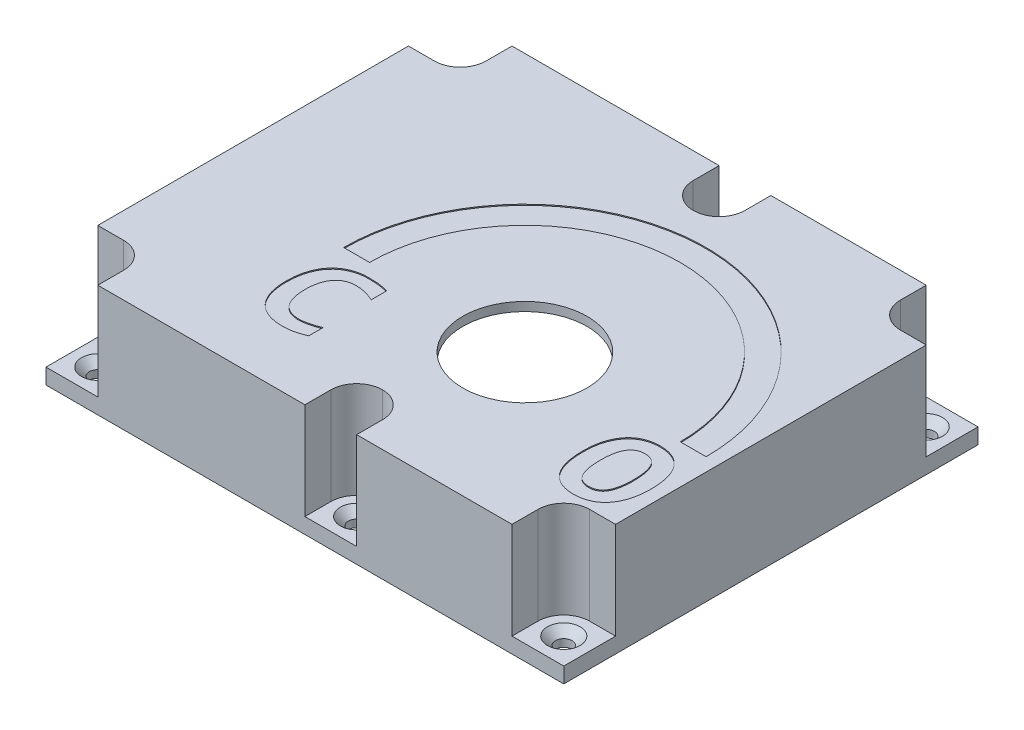
from build123d import *

# Parameters (mm, degrees)
BOSS_EXTRUDE4_DEPTH                          = 20
BOSS_EXTRUDE5_DEPTH                          = 3
BOSS_EXTRUDE6_DEPTH                          = 1.7
CSK_FOR_M3_COUNTERSUNK_FLAT_HEAD_SCR_2_COUNT = 2
CSK_FOR_M3_COUNTERSUNK_FLAT_HEAD_SCR_2_PITCH = 89.998
CSK_FOR_M3_COUNTERSUNK_FLAT_HEAD_SCR_3_COUNT = 2
CSK_FOR_M3_COUNTERSUNK_FLAT_HEAD_SCR_3_PITCH = 114.014735925
CSK_FOR_M3_COUNTERSUNK_FLAT_HEAD_SCR_4_COUNT = 2
CSK_FOR_M3_COUNTERSUNK_FLAT_HEAD_SCR_4_PITCH = 69.998
CSK_FOR_M3_COUNTERSUNK_FLAT_HEAD_SCR_5_COUNT = 2
CSK_FOR_M3_COUNTERSUNK_FLAT_HEAD_SCR_5_PITCH = 86.020462728
CSK_FOR_M3_COUNTERSUNK_FLAT_HEAD_SCR_6_COUNT = 2
CSK_FOR_M3_COUNTERSUNK_FLAT_HEAD_SCR_6_PITCH = 49.998
SKETCH7_R                                    = 12
CUT_EXTRUDE1_DEPTH                           = 69.856850528
CUT_EXTRUDE2_DEPTH                           = 0.2


with BuildPart() as part:
    # Sketch1 → Boss-Extrude4 (new body)
    with BuildSketch(Plane(origin=(0, 0, 0), x_dir=(1, 0, 0), z_dir=(0, 1, 0))):
        with BuildLine():
            Line((-49.242001852, 28.84175066), (-44.241001852, 28.84175066))
            ThreePointArc((-44.241001852, 28.84175066), (-40.706175053, 30.305923861), (-39.242001852, 33.84075066))
            Line((-39.242001852, 33.84075066), (-39.242001852, 38.84175066))
            Line((-39.242001852, 38.84175066), (0.757998148, 38.84175066))
            Line((0.757998148, 38.84175066), (0.757998148, 33.84075066))
            ThreePointArc((0.757998148, 33.84075066), (2.222171348, 30.305923861), (5.756998148, 28.84175066))
            Line((5.756998148, 28.84175066), (5.758998148, 28.84175066))
            ThreePointArc((5.758998148, 28.84175066), (9.293824947, 30.305923861), (10.757998148, 33.84075066))
            Line((10.757998148, 33.84075066), (10.757998148, 38.84175066))
            Line((10.757998148, 38.84175066), (40.757998148, 38.84175066))
            Line((40.757998148, 38.84175066), (40.757998148, 33.84075066))
            ThreePointArc((40.757998148, 33.84075066), (42.222171348, 30.305923861), (45.756998148, 28.84175066))
            Line((45.756998148, 28.84175066), (50.757998148, 28.84175066))
            Line((50.757998148, 28.84175066), (50.757998148, -31.15824934))
            Line((50.757998148, -31.15824934), (45.756998148, -31.15824934))
            ThreePointArc((45.756998148, -31.15824934), (42.222171348, -32.62242254), (40.757998148, -36.15724934))
            Line((40.757998148, -36.15724934), (40.757998148, -41.15824934))
            Line((40.757998148, -41.15824934), (10.757998148, -41.15824934))
            Line((10.757998148, -41.15824934), (10.757998148, -36.15724934))
            ThreePointArc((10.757998148, -36.15724934), (9.293824947, -32.62242254), (5.758998148, -31.15824934))
            Line((5.758998148, -31.15824934), (5.756998148, -31.15824934))
            ThreePointArc((5.756998148, -31.15824934), (2.222171348, -32.62242254), (0.757998148, -36.15724934))
            Line((0.757998148, -36.15724934), (0.757998148, -41.15824934))
            Line((0.757998148, -41.15824934), (-39.242001852, -41.15824934))
            Line((-39.242001852, -41.15824934), (-39.242001852, -36.15724934))
            ThreePointArc((-39.242001852, -36.15724934), (-40.706175053, -32.62242254), (-44.241001852, -31.15824934))
            Line((-44.241001852, -31.15824934), (-49.242001852, -31.15824934))
            Line((-49.242001852, -31.15824934), (-49.242001852, 28.84175066))
        make_face()
        with BuildLine():
            Line((-47.742001852, 27.34175066), (-44.241001852, 27.34175066))
            ThreePointArc((-44.241001852, 27.34175066), (-39.645514881, 29.245263689), (-37.742001852, 33.84075066))
            Line((-37.742001852, 33.84075066), (-37.742001852, 37.34175066))
            Line((-37.742001852, 37.34175066), (-0.742001852, 37.34175066))
            Line((-0.742001852, 37.34175066), (-0.742001852, 33.84075066))
            ThreePointArc((-0.742001852, 33.84075066), (1.161511177, 29.245263689), (5.756998148, 27.34175066))
            Line((5.756998148, 27.34175066), (5.758998148, 27.34175066))
            ThreePointArc((5.758998148, 27.34175066), (10.354485119, 29.245263689), (12.257998148, 33.84075066))
            Line((12.257998148, 33.84075066), (12.257998148, 37.34175066))
            Line((12.257998148, 37.34175066), (39.257998148, 37.34175066))
            Line((39.257998148, 37.34175066), (39.257998148, 33.84075066))
            ThreePointArc((39.257998148, 33.84075066), (41.161511177, 29.245263689), (45.756998148, 27.34175066))
            Line((45.756998148, 27.34175066), (49.257998148, 27.34175066))
            Line((49.257998148, 27.34175066), (49.257998148, -29.65824934))
            Line((49.257998148, -29.65824934), (45.756998148, -29.65824934))
            ThreePointArc((45.756998148, -29.65824934), (41.161511177, -31.561762369), (39.257998148, -36.15724934))
            Line((39.257998148, -36.15724934), (39.257998148, -39.65824934))
            Line((39.257998148, -39.65824934), (12.257998148, -39.65824934))
            Line((12.257998148, -39.65824934), (12.257998148, -36.15724934))
            ThreePointArc((12.257998148, -36.15724934), (10.354485119, -31.561762369), (5.758998148, -29.65824934))
            Line((5.758998148, -29.65824934), (5.756998148, -29.65824934))
            ThreePointArc((5.756998148, -29.65824934), (1.161511177, -31.561762369), (-0.742001852, -36.15724934))
            Line((-0.742001852, -36.15724934), (-0.742001852, -39.65824934))
            Line((-0.742001852, -39.65824934), (-37.742001852, -39.65824934))
            Line((-37.742001852, -39.65824934), (-37.742001852, -36.15724934))
            ThreePointArc((-37.742001852, -36.15724934), (-39.645514881, -31.561762369), (-44.241001852, -29.65824934))
            Line((-44.241001852, -29.65824934), (-47.742001852, -29.65824934))
            Line((-47.742001852, -29.65824934), (-47.742001852, 27.34175066))
        make_face(mode=Mode.SUBTRACT)
    extrude(amount=BOSS_EXTRUDE4_DEPTH)

    # Sketch2 → Boss-Extrude5 (add)
    with BuildSketch(Plane.XZ):
        with BuildLine():
            Line((0.757998148, -38.84175066), (10.757998148, -38.84175066))
            Line((10.757998148, -38.84175066), (10.757998148, -33.84075066))
            ThreePointArc((10.757998148, -33.84075066), (9.293824947, -30.305923861), (5.758998148, -28.84175066))
            Line((5.758998148, -28.84175066), (5.756998148, -28.84175066))
            ThreePointArc((5.756998148, -28.84175066), (2.222171348, -30.305923861), (0.757998148, -33.84075066))
            Line((0.757998148, -33.84075066), (0.757998148, -38.84175066))
        make_face()
        with BuildLine():
            Line((-49.242001852, -38.84175066), (-39.242001852, -38.84175066))
            Line((-39.242001852, -38.84175066), (-39.242001852, -33.84075066))
            ThreePointArc((-39.242001852, -33.84075066), (-40.706175053, -30.305923861), (-44.241001852, -28.84175066))
            Line((-44.241001852, -28.84175066), (-49.242001852, -28.84175066))
            Line((-49.242001852, -28.84175066), (-49.242001852, -38.84175066))
        make_face()
        with BuildLine():
            Line((-49.242001852, 41.15824934), (-39.242001852, 41.15824934))
            Line((-39.242001852, 41.15824934), (-39.242001852, 36.15724934))
            ThreePointArc((-39.242001852, 36.15724934), (-40.706175053, 32.62242254), (-44.241001852, 31.15824934))
            Line((-44.241001852, 31.15824934), (-49.242001852, 31.15824934))
            Line((-49.242001852, 31.15824934), (-49.242001852, 41.15824934))
        make_face()
        with BuildLine():
            Line((50.757998148, 41.15824934), (40.757998148, 41.15824934))
            Line((40.757998148, 41.15824934), (40.757998148, 36.15724934))
            ThreePointArc((40.757998148, 36.15724934), (42.222171348, 32.62242254), (45.756998148, 31.15824934))
            Line((45.756998148, 31.15824934), (50.757998148, 31.15824934))
            Line((50.757998148, 31.15824934), (50.757998148, 41.15824934))
        make_face()
        with BuildLine():
            Line((50.757998148, -38.84175066), (40.757998148, -38.84175066))
            Line((40.757998148, -38.84175066), (40.757998148, -33.84075066))
            ThreePointArc((40.757998148, -33.84075066), (42.222171348, -30.305923861), (45.756998148, -28.84175066))
            Line((45.756998148, -28.84175066), (50.757998148, -28.84175066))
            Line((50.757998148, -28.84175066), (50.757998148, -38.84175066))
        make_face()
        with BuildLine():
            Line((0.757998148, 41.15824934), (10.757998148, 41.15824934))
            Line((10.757998148, 41.15824934), (10.757998148, 36.15724934))
            ThreePointArc((10.757998148, 36.15724934), (9.293824947, 32.62242254), (5.758998148, 31.15824934))
            Line((5.758998148, 31.15824934), (5.756998148, 31.15824934))
            ThreePointArc((5.756998148, 31.15824934), (2.222171348, 32.62242254), (0.757998148, 36.15724934))
            Line((0.757998148, 36.15724934), (0.757998148, 41.15824934))
        make_face()
    extrude(amount=-BOSS_EXTRUDE5_DEPTH)

    # Sketch3 → Boss-Extrude6 (add)
    with BuildSketch(Plane(origin=(0, 20, 0), x_dir=(1, 0, 0), z_dir=(0, 1, 0))):
        with BuildLine():
            Line((-39.242001852, -41.15824934), (0.757998148, -41.15824934))
            Line((0.757998148, -41.15824934), (0.757998148, -36.15724934))
            ThreePointArc((0.757998148, -36.15724934), (2.222171348, -32.62242254), (5.756998148, -31.15824934))
            Line((5.756998148, -31.15824934), (5.758998148, -31.15824934))
            ThreePointArc((5.758998148, -31.15824934), (9.293824947, -32.62242254), (10.757998148, -36.15724934))
            Line((10.757998148, -36.15724934), (10.757998148, -41.15824934))
            Line((10.757998148, -41.15824934), (40.757998148, -41.15824934))
            Line((40.757998148, -41.15824934), (40.757998148, -36.15724934))
            ThreePointArc((40.757998148, -36.15724934), (42.222171348, -32.62242254), (45.756998148, -31.15824934))
            Line((45.756998148, -31.15824934), (50.757998148, -31.15824934))
            Line((50.757998148, -31.15824934), (50.757998148, 28.84175066))
            Line((50.757998148, 28.84175066), (45.756998148, 28.84175066))
            ThreePointArc((45.756998148, 28.84175066), (42.222171348, 30.305923861), (40.757998148, 33.84075066))
            Line((40.757998148, 33.84075066), (40.757998148, 38.84175066))
            Line((40.757998148, 38.84175066), (10.757998148, 38.84175066))
            Line((10.757998148, 38.84175066), (10.757998148, 33.84075066))
            ThreePointArc((10.757998148, 33.84075066), (9.293824947, 30.305923861), (5.758998148, 28.84175066))
            Line((5.758998148, 28.84175066), (5.756998148, 28.84175066))
            ThreePointArc((5.756998148, 28.84175066), (2.222171348, 30.305923861), (0.757998148, 33.84075066))
            Line((0.757998148, 33.84075066), (0.757998148, 38.84175066))
            Line((0.757998148, 38.84175066), (-39.242001852, 38.84175066))
            Line((-39.242001852, 38.84175066), (-39.242001852, 33.84075066))
            ThreePointArc((-39.242001852, 33.84075066), (-40.706175053, 30.305923861), (-44.241001852, 28.84175066))
            Line((-44.241001852, 28.84175066), (-49.242001852, 28.84175066))
            Line((-49.242001852, 28.84175066), (-49.242001852, -31.15824934))
            Line((-49.242001852, -31.15824934), (-44.241001852, -31.15824934))
            ThreePointArc((-44.241001852, -31.15824934), (-40.706175053, -32.62242254), (-39.242001852, -36.15724934))
            Line((-39.242001852, -36.15724934), (-39.242001852, -41.15824934))
        make_face()
    extrude(amount=BOSS_EXTRUDE6_DEPTH)

    # Sketch5 → CSK for M3 Countersunk Flat Head Screw1 (revolve, cut)
    with BuildSketch(Plane(origin=(-44.241001852, 3, -33.84075066), x_dir=(0, 0, 1), z_dir=(1, 0, 0))):
        Polygon((0, 0), (0, 3), (1.6, 3), (1.6, 1.55), (3.15, 0), align=None)
    csk_for_m3_countersunk_flat_head_screw1 = revolve(axis=Axis((-44.241001852, 9.35, -33.84075066), (0, -1, 0)), mode=Mode.SUBTRACT)

    # CSK for M3 Countersunk Flat Head Scr 2: CSK for M3 Countersunk Flat Head Screw1 ×2
    with Locations(*[(i * CSK_FOR_M3_COUNTERSUNK_FLAT_HEAD_SCR_2_PITCH, 0, 0) for i in range(1, CSK_FOR_M3_COUNTERSUNK_FLAT_HEAD_SCR_2_COUNT)]):
        add(csk_for_m3_countersunk_flat_head_screw1, mode=Mode.SUBTRACT)

    # CSK for M3 Countersunk Flat Head Scr 3: CSK for M3 Countersunk Flat Head Screw1 ×2
    with Locations(*[Vector(0.789354106467132, 0, 0.6139381846761739) * (i * CSK_FOR_M3_COUNTERSUNK_FLAT_HEAD_SCR_3_PITCH) for i in range(1, CSK_FOR_M3_COUNTERSUNK_FLAT_HEAD_SCR_3_COUNT)]):
        add(csk_for_m3_countersunk_flat_head_screw1, mode=Mode.SUBTRACT)

    # CSK for M3 Countersunk Flat Head Scr 4: CSK for M3 Countersunk Flat Head Screw1 ×2
    with Locations(*[(0, 0, i * CSK_FOR_M3_COUNTERSUNK_FLAT_HEAD_SCR_4_PITCH) for i in range(1, CSK_FOR_M3_COUNTERSUNK_FLAT_HEAD_SCR_4_COUNT)]):
        add(csk_for_m3_countersunk_flat_head_screw1, mode=Mode.SUBTRACT)

    # CSK for M3 Countersunk Flat Head Scr 5: CSK for M3 Countersunk Flat Head Screw1 ×2
    with Locations(*[Vector(0.5812337950086401, 0, 0.8137366131248208) * (i * CSK_FOR_M3_COUNTERSUNK_FLAT_HEAD_SCR_5_PITCH) for i in range(1, CSK_FOR_M3_COUNTERSUNK_FLAT_HEAD_SCR_5_COUNT)]):
        add(csk_for_m3_countersunk_flat_head_screw1, mode=Mode.SUBTRACT)

    # CSK for M3 Countersunk Flat Head Scr 6: CSK for M3 Countersunk Flat Head Screw1 ×2
    with Locations(*[(i * CSK_FOR_M3_COUNTERSUNK_FLAT_HEAD_SCR_6_PITCH, 0, 0) for i in range(1, CSK_FOR_M3_COUNTERSUNK_FLAT_HEAD_SCR_6_COUNT)]):
        add(csk_for_m3_countersunk_flat_head_screw1, mode=Mode.SUBTRACT)

    # Sketch7 → Cut-Extrude1 (cut, through all)
    with BuildSketch(Plane(origin=(0, 21.7, 0), x_dir=(1, 0, 0), z_dir=(0, 1, 0))):
        with Locations((13.196395148, -11.10824934)):
            Circle(SKETCH7_R)
    extrude(amount=-CUT_EXTRUDE1_DEPTH, mode=Mode.SUBTRACT)

    # Sketch8 → Cut-Extrude2 (cut)
    # profile 1 of 3: a face of its own
    with BuildSketch(Plane(origin=(0, 21.7, 0), x_dir=(1, 0, 0), z_dir=(0, 1, 0))):
        with BuildLine():
            Line((-21.803604852, -11.10824934), (-16.803604852, -11.10824934))
            ThreePointArc((-16.803604852, -11.10824934), (13.196395148, 18.89175066), (43.196395148, -11.10824934))
            Line((43.196395148, -11.10824934), (48.196395148, -11.10824934))
            ThreePointArc((48.196395148, -11.10824934), (13.196395148, 23.89175066), (-21.803604852, -11.10824934))
        make_face()
    # profile 2 of 3: a face of its own
    with BuildSketch(Plane(origin=(0, 21.7, 0), x_dir=(1, 0, 0), z_dir=(0, 1, 0))):
        with BuildLine():
            add(Edge.make_bspline(
                [(-10.396498961, -29.259797973), (-10.573314527, -29.335278245), (-10.920221238, -29.48336822), (-11.444570062, -29.671129892), (-11.959348773, -29.831566568), (-12.469472256, -29.962814931), (-12.98054775, -30.067349926), (-13.499084516, -30.132721024), (-14.027284378, -30.179669837), (-14.383105842, -30.184758925), (-14.563165627, -30.187334205)],
                knots=[0, 0, 0, 0, 1.072602722, 2.104413604, 3.106297595, 4.08050826, 5.042709706, 6.014913564, 6.995467464, 8, 8, 8, 8], degree=3))
            add(Edge.make_bspline(
                [(-14.563165627, -30.187334205), (-14.844837842, -30.181169268), (-15.391718815, -30.169199729), (-16.188564586, -30.073701447), (-16.934741206, -29.915932829), (-17.632891547, -29.695682978), (-18.277842104, -29.407901385), (-18.872657472, -29.058520638), (-19.416216233, -28.647462597), (-19.904749664, -28.17249708), (-20.339115032, -27.636928751), (-20.712222144, -27.035932958), (-21.035722157, -26.378842147), (-21.300038931, -25.659761229), (-21.505712873, -24.88080498), (-21.651445503, -24.041987971), (-21.744612489, -23.143539517), (-21.753985988, -22.524533076), (-21.758817801, -22.205450147)],
                knots=[0, 0, 0, 0, 1.102605573, 2.140764961, 3.136846793, 4.08496906, 5.001529512, 5.896051515, 6.780328523, 7.66316301, 8.557497515, 9.473264751, 10.427030373, 11.420482266, 12.467702166, 13.577100782, 14.751053738, 16, 16, 16, 16], degree=3))
            add(Edge.make_bspline(
                [(-21.758817801, -22.205450147), (-21.753020793, -21.877873923), (-21.741720306, -21.239308133), (-21.64068115, -20.310656542), (-21.485903156, -19.435444011), (-21.255249511, -18.61948282), (-20.971529992, -17.858758099), (-20.625119114, -17.161267504), (-20.230584606, -16.52061109), (-19.774598046, -15.945511472), (-19.266115236, -15.431674365), (-18.703110104, -14.983821646), (-18.092449887, -14.596458925), (-17.427230473, -14.281090705), (-16.716558276, -14.032181855), (-15.962162969, -13.849280887), (-15.163954116, -13.744463707), (-14.617819052, -13.730637005), (-14.338527946, -13.723566089)],
                knots=[0, 0, 0, 0, 1.232307787, 2.402218284, 3.511138658, 4.573037126, 5.588482404, 6.562047137, 7.499038646, 8.414657469, 9.317692522, 10.213424542, 11.116219401, 12.033010505, 12.977368732, 13.94518829, 14.949178196, 16, 16, 16, 16], degree=3))
            add(Edge.make_bspline(
                [(-14.338527946, -13.723566089), (-14.159751698, -13.723403967), (-13.812965973, -13.723089488), (-13.305838054, -13.745265677), (-12.819430822, -13.764983228), (-12.343931668, -13.817102901), (-11.869265438, -13.874419396), (-11.389814283, -13.964024422), (-10.895703153, -14.055867222), (-10.56510249, -14.142931939), (-10.396498961, -14.187334205)],
                knots=[0, 0, 0, 0, 1.077376558, 2.089868288, 3.059369192, 4.010411707, 4.972009834, 5.940198088, 6.949518525, 8, 8, 8, 8], degree=3))
            Line((-10.396498961, -14.187334205), (-10.396498961, -17.201826959))
            add(Edge.make_bspline(
                [(-10.396498961, -17.201826959), (-10.569545275, -17.122473778), (-10.908395722, -16.967088436), (-11.421302513, -16.773426911), (-11.919172753, -16.60694656), (-12.406092719, -16.486678353), (-12.872549614, -16.390860897), (-13.320279318, -16.326209797), (-13.745944181, -16.284176232), (-14.0232221, -16.277513932), (-14.157368526, -16.274290727)],
                knots=[0, 0, 0, 0, 1.170030163, 2.291093263, 3.368831198, 4.395296508, 5.372370687, 6.295361994, 7.175300008, 8, 8, 8, 8], degree=3))
            add(Edge.make_bspline(
                [(-14.157368526, -16.274290727), (-14.343626832, -16.278839992), (-14.703318662, -16.287625284), (-15.222789202, -16.36404356), (-15.700199105, -16.493321097), (-16.134970083, -16.676444744), (-16.530703695, -16.904056165), (-16.891918513, -17.171701803), (-17.212154031, -17.487149994), (-17.495643502, -17.840450571), (-17.743503894, -18.232334448), (-17.956209187, -18.659928664), (-18.134839804, -19.123232356), (-18.273477859, -19.620097953), (-18.382242945, -20.145567331), (-18.456094608, -20.697759002), (-18.505618896, -21.274592286), (-18.510136811, -21.667902012), (-18.51244099, -21.868493625)],
                knots=[0, 0, 0, 0, 1.109729706, 2.143049175, 3.121026665, 4.050204485, 4.946654748, 5.836403406, 6.722153568, 7.618170183, 8.530804457, 9.480502004, 10.460411604, 11.48580219, 12.551706219, 13.656287425, 14.804684813, 16, 16, 16, 16], degree=3))
            add(Edge.make_bspline(
                [(-18.51244099, -21.868493625), (-18.510625079, -22.079989997), (-18.507080983, -22.492765429), (-18.451576354, -23.093326732), (-18.380386672, -23.661946317), (-18.267318965, -24.193374217), (-18.124827167, -24.689220238), (-17.941614702, -25.144345115), (-17.729530403, -25.564042085), (-17.477751205, -25.943278594), (-17.19106763, -26.284382687), (-16.862449902, -26.578045712), (-16.498909655, -26.831426004), (-16.098347729, -27.043226346), (-15.656971004, -27.20574791), (-15.177681009, -27.319735733), (-14.660975399, -27.395425331), (-14.302581938, -27.401558462), (-14.117513454, -27.404725509)],
                knots=[0, 0, 0, 0, 1.256876421, 2.453033611, 3.583260076, 4.661975506, 5.679853963, 6.646528144, 7.574590913, 8.470745685, 9.346915849, 10.216322401, 11.082788599, 11.975686973, 12.902638023, 13.870910894, 14.900573425, 16, 16, 16, 16], degree=3))
            add(Edge.make_bspline(
                [(-14.117513454, -27.404725509), (-13.974817092, -27.401246203), (-13.677465511, -27.393996003), (-13.219150884, -27.330924396), (-12.742242334, -27.240946888), (-12.254629302, -27.128925698), (-11.768709573, -26.991840752), (-11.290657609, -26.832856419), (-10.832763086, -26.661925044), (-10.538607842, -26.537365193), (-10.396498961, -26.477189277)],
                knots=[0, 0, 0, 0, 0.887372101, 1.849111607, 2.873273884, 3.906654629, 4.960374994, 6.012916101, 7.040022999, 8, 8, 8, 8], degree=3))
            Line((-10.396498961, -26.477189277), (-10.396498961, -29.259797973))
        make_face()
    # profile 3 of 3: a face of its own
    with BuildSketch(Plane(origin=(0, 21.7, 0), x_dir=(1, 0, 0), z_dir=(0, 1, 0))):
        with BuildLine():
            add(Edge.make_bspline(
                [(48.288169612, -21.882986379), (48.281934393, -22.232222204), (48.2698927, -22.906679687), (48.17715597, -23.882292954), (48.015343131, -24.782740229), (47.790807674, -25.609269454), (47.511781895, -26.361835667), (47.185018858, -27.045997379), (46.809113946, -27.660682489), (46.383101569, -28.205238884), (45.911242002, -28.677411264), (45.407323998, -29.092363154), (44.85745519, -29.434113844), (44.274040016, -29.713034081), (43.661199668, -29.927102902), (43.024063519, -30.072886633), (42.36864252, -30.17326193), (41.922609317, -30.182615447), (41.697589902, -30.187334205)],
                knots=[0, 0, 0, 0, 1.399094986, 2.701985343, 3.921606295, 5.060250114, 6.128937938, 7.133140352, 8.093336986, 9.010033534, 9.896223585, 10.76303321, 11.619598843, 12.483160966, 13.349322064, 14.214333538, 15.099148625, 16, 16, 16, 16], degree=3))
            add(Edge.make_bspline(
                [(41.697589902, -30.187334205), (41.44000843, -30.181503098), (40.939787298, -30.170179135), (40.21389656, -30.070266862), (39.536750234, -29.909248691), (38.908523545, -29.680771258), (38.33060482, -29.38474179), (37.801075928, -29.024564694), (37.322771526, -28.59555895), (36.893778525, -28.103709394), (36.515428588, -27.548624741), (36.190028737, -26.932860844), (35.913561348, -26.258129713), (35.692805661, -25.524383717), (35.512369675, -24.734451413), (35.394752843, -23.884599435), (35.315565874, -22.976275047), (35.307052353, -22.350562067), (35.302662366, -22.027913915)],
                knots=[0, 0, 0, 0, 1.046182631, 2.031678192, 2.97076483, 3.86965419, 4.740954983, 5.602542005, 6.464464361, 7.344346083, 8.248138063, 9.187737429, 10.169205071, 11.206116273, 12.297806163, 13.458167033, 14.68930686, 16, 16, 16, 16], degree=3))
            add(Edge.make_bspline(
                [(35.302662366, -22.027913915), (35.308804581, -21.678663715), (35.32066666, -21.004178471), (35.414518389, -20.030155894), (35.571641055, -19.130406785), (35.795346459, -18.304342614), (36.080866733, -17.552727346), (36.404530236, -16.865517524), (36.781893285, -16.250290991), (37.207695772, -15.705662695), (37.679564201, -15.233418033), (38.18364063, -14.818812105), (38.732434806, -14.47604017), (39.31772961, -14.202134026), (39.931104165, -13.98760923), (40.567620863, -13.837798391), (41.223403685, -13.737612608), (41.668228677, -13.728284623), (41.893242076, -13.723566089)],
                knots=[0, 0, 0, 0, 1.399147349, 2.702086469, 3.916134137, 5.054820572, 6.125245074, 7.133847534, 8.094080105, 9.010810961, 9.897034179, 10.763876246, 11.620473937, 12.481991629, 13.348185144, 14.219056267, 15.099114909, 16, 16, 16, 16], degree=3))
            add(Edge.make_bspline(
                [(41.893242076, -13.723566089), (42.150822259, -13.729399085), (42.651040889, -13.740726715), (43.376949285, -13.840613108), (44.054033257, -14.001722661), (44.682478905, -14.229879205), (45.259009864, -14.526744898), (45.790904607, -14.882232572), (46.267852401, -15.31199109), (46.697234797, -15.803427449), (47.074269617, -16.358060412), (47.401916085, -16.971421728), (47.67628349, -17.644659529), (47.899310013, -18.377695574), (48.078216497, -19.169303518), (48.196136077, -20.022669446), (48.275137133, -20.933433026), (48.283741368, -21.560342155), (48.288169612, -21.882986379)],
                knots=[0, 0, 0, 0, 1.04600235, 2.031328089, 2.970252902, 3.868987364, 4.740138012, 5.59881955, 6.460593378, 7.340323477, 8.243959714, 9.179069388, 10.160367901, 11.192410958, 12.288699193, 13.453715767, 14.689532722, 16, 16, 16, 16], degree=3))
        make_face()
        with BuildLine():
            add(Edge.make_bspline(
                [(45.0417928, -22.027913915), (45.040225405, -21.803214961), (45.037189508, -21.367994285), (44.999190914, -20.737142621), (44.943917298, -20.150388866), (44.861171742, -19.60824035), (44.752760888, -19.110992155), (44.622836769, -18.656884232), (44.473489196, -18.245257262), (44.293473833, -17.879485614), (44.093418679, -17.552538174), (43.853507371, -17.27299502), (43.583515066, -17.037688374), (43.288073917, -16.83674951), (42.956457265, -16.688113866), (42.595053834, -16.585103552), (42.204928095, -16.517362643), (41.934600402, -16.509977299), (41.795415989, -16.506174785)],
                knots=[0, 0, 0, 0, 1.486095503, 2.8784268, 4.178896477, 5.383313849, 6.50370181, 7.542880676, 8.505944191, 9.395566462, 10.23559869, 11.034510805, 11.821349203, 12.599050339, 13.389126436, 14.213243526, 15.080047443, 16, 16, 16, 16], degree=3))
            add(Edge.make_bspline(
                [(41.795415989, -16.506174785), (41.656267155, -16.51008969), (41.387200015, -16.517659802), (40.998193364, -16.583343815), (40.640793843, -16.695411249), (40.315360364, -16.852481006), (40.020144666, -17.051551071), (39.754918716, -17.29348232), (39.5134137, -17.575413198), (39.300167578, -17.899492523), (39.114799885, -18.264271853), (38.961586333, -18.670133899), (38.82570284, -19.112294485), (38.723763088, -19.595262547), (38.64357947, -20.114182592), (38.592753572, -20.670889863), (38.553443677, -21.264073201), (38.5505352, -21.672767641), (38.549039177, -21.882986379)],
                knots=[0, 0, 0, 0, 0.940493395, 1.818598556, 2.65806311, 3.465325826, 4.253609174, 5.057352584, 5.885618443, 6.757702066, 7.674492596, 8.646685703, 9.687886232, 10.799631583, 11.981266591, 13.236822997, 14.578714251, 16, 16, 16, 16], degree=3))
            add(Edge.make_bspline(
                [(38.549039177, -21.882986379), (38.550727647, -22.10767411), (38.553998052, -22.542873049), (38.590365836, -23.173998761), (38.651269166, -23.760353689), (38.73463683, -24.303321253), (38.837134542, -24.802670026), (38.966003107, -25.257752793), (39.124163373, -25.666130325), (39.297645459, -26.035288534), (39.507513364, -26.358106427), (39.743109031, -26.63993458), (40.010630263, -26.879555723), (40.310786004, -27.072373774), (40.640325508, -27.222528662), (40.999391713, -27.325793092), (41.387062149, -27.393760701), (41.656220161, -27.400987928), (41.795415989, -27.404725509)],
                knots=[0, 0, 0, 0, 1.486662466, 2.879524953, 4.181300558, 5.38617743, 6.513130284, 7.552705609, 8.511484829, 9.408629925, 10.246547046, 11.051854149, 11.833006184, 12.613299248, 13.403676768, 14.220441868, 15.079696471, 16, 16, 16, 16], degree=3))
            add(Edge.make_bspline(
                [(41.795415989, -27.404725509), (41.934533374, -27.400686016), (42.204730882, -27.392840405), (42.595327446, -27.328419503), (42.952525359, -27.214376077), (43.28193185, -27.062564925), (43.576272441, -26.858494522), (43.846933477, -26.620005999), (44.084223064, -26.334853646), (44.295006374, -26.011550616), (44.473937764, -25.644700711), (44.635569393, -25.244113434), (44.759126595, -24.799572539), (44.864944876, -24.318396244), (44.941842391, -23.797553441), (44.99961684, -23.240306536), (45.036963672, -22.646779151), (45.040152549, -22.23811637), (45.0417928, -22.027913915)],
                knots=[0, 0, 0, 0, 0.940029382, 1.82575022, 2.664800606, 3.468147471, 4.267377886, 5.076798435, 5.899366548, 6.766536204, 7.679194691, 8.653886611, 9.682108903, 10.79330575, 11.982426563, 13.238186273, 14.579415474, 16, 16, 16, 16], degree=3))
        make_face(mode=Mode.SUBTRACT)
    extrude(amount=-CUT_EXTRUDE2_DEPTH, mode=Mode.SUBTRACT)


solid = part.part
